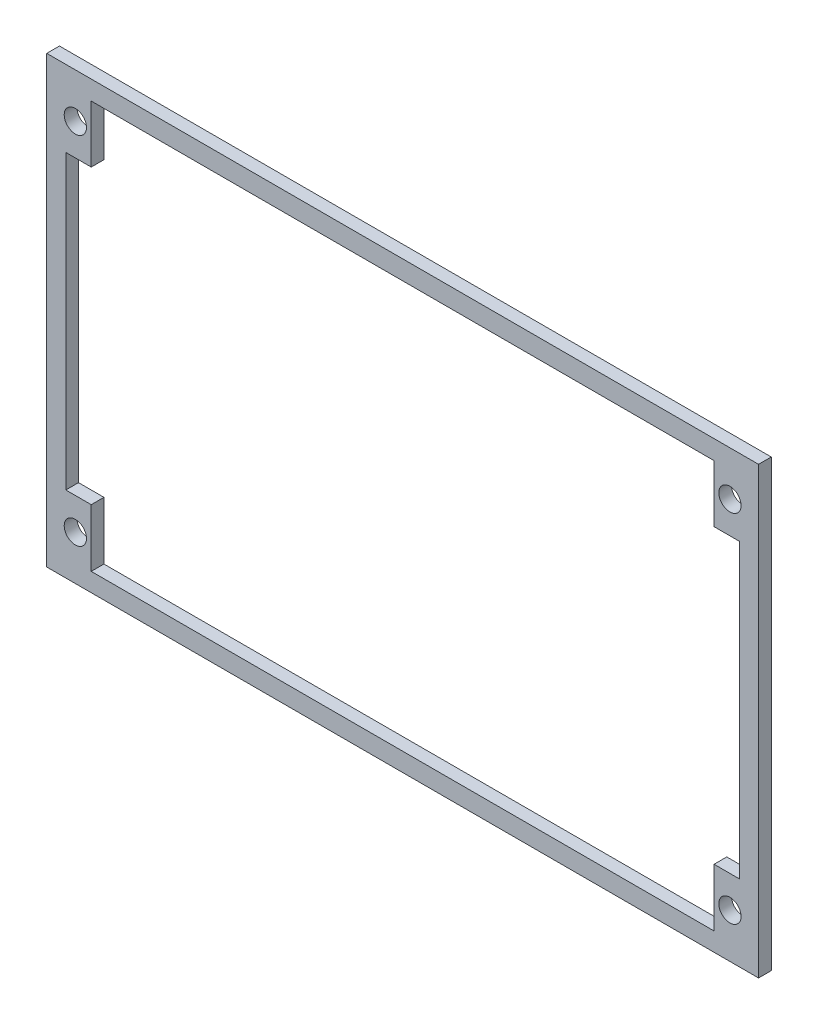
from build123d import *

# Parameters (mm, degrees)
SKETCH1_W           = 112
SKETCH1_H           = 70
BOSS_EXTRUDE1_DEPTH = 2
SKETCH2_W           = 98
SKETCH2_H           = 64.091260174
CUT_EXTRUDE1_DEPTH  = 133.090877808
SKETCH3_W           = 4
SKETCH3_H           = 46
CUT_EXTRUDE2_DEPTH  = 133.090877808
SKETCH4_R           = 1.75
CUT_EXTRUDE3_DEPTH  = 133.090877808


with BuildPart() as part:
    # Sketch1 → Boss-Extrude1 (new body)
    with BuildSketch(Plane.XY):
        with Locations((56, 35)):
            Rectangle(SKETCH1_W, SKETCH1_H)
    extrude(amount=BOSS_EXTRUDE1_DEPTH)

    # Sketch2 → Cut-Extrude1 (cut, through all)
    with BuildSketch(Plane.XY.offset(2)):
        with Locations((56, 34.954369913)):
            Rectangle(SKETCH2_W, SKETCH2_H)
    extrude(amount=-CUT_EXTRUDE1_DEPTH, mode=Mode.SUBTRACT)

    # Sketch3 → Cut-Extrude2 (cut, through all)
    with BuildSketch(Plane.XY.offset(2)):
        with Locations((5, 35)):
            Rectangle(SKETCH3_W, SKETCH3_H)
        with Locations((107, 35)):
            Rectangle(SKETCH3_W, SKETCH3_H)
    extrude(amount=-CUT_EXTRUDE2_DEPTH, mode=Mode.SUBTRACT)

    # Sketch4 → Cut-Extrude3 (cut, through all)
    with BuildSketch(Plane.XY.offset(2)):
        with Locations((4.5, 63)):
            Circle(SKETCH4_R)
        with Locations((4.5, 7)):
            Circle(SKETCH4_R)
        with Locations((107.5, 7)):
            Circle(SKETCH4_R)
        with Locations((107.5, 63)):
            Circle(SKETCH4_R)
    extrude(amount=-CUT_EXTRUDE3_DEPTH, mode=Mode.SUBTRACT)


solid = part.part
